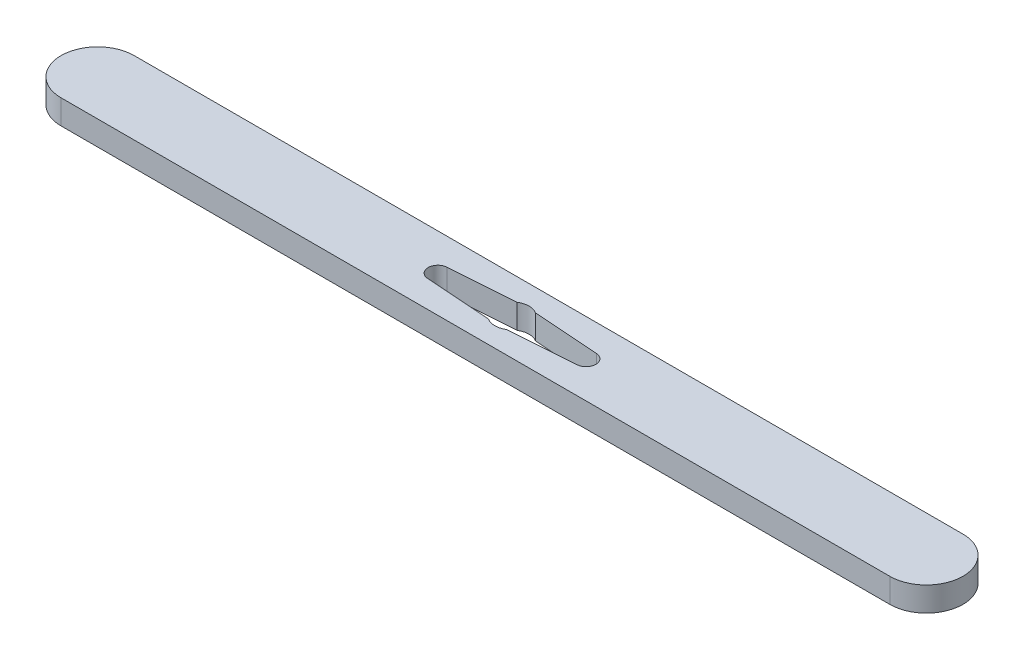
from build123d import *

# Parameters (mm, degrees)
BOSS_EXTRUDE1_DEPTH = 5
CUT_EXTRUDE3_DEPTH  = 93.938151477


with BuildPart() as part:
    # Sketch2 → Boss-Extrude1 (new body)
    with BuildSketch(Plane(origin=(0, 0, 0), x_dir=(1, 0, 0), z_dir=(0, 1, 0))):
        with BuildLine():
            ThreePointArc((85, -7.5), (92.5, 0), (85, 7.5))
            Line((85, 7.5), (-85, 7.5))
            ThreePointArc((-85, 7.5), (-92.5, 0), (-85, -7.5))
            Line((-85, -7.5), (85, -7.5))
        make_face()
    extrude(amount=BOSS_EXTRUDE1_DEPTH)

    # Sketch2<5> → Cut-Extrude3 (cut, through all)
    with BuildSketch(Plane(origin=(0, 0, 0), x_dir=(1, 0, 0), z_dir=(0, 1, 0))):
        with BuildLine():
            Line((-15.34156858, -1.994983292), (-1.88348082, -2.95))
            ThreePointArc((-1.88348082, -2.95), (0, -3.5), (1.88348082, -2.95))
            Line((1.88348082, -2.95), (15.34156858, -1.994983292))
            ThreePointArc((15.34156858, -1.994983292), (17.2, 0), (15.34156858, 1.994983292))
            Line((15.34156858, 1.994983292), (1.88348082, 2.95))
            ThreePointArc((1.88348082, 2.95), (0, 3.5), (-1.88348082, 2.95))
            Line((-1.88348082, 2.95), (-15.34156858, 1.994983292))
            ThreePointArc((-15.34156858, 1.994983292), (-17.2, 0), (-15.34156858, -1.994983292))
        make_face()
    extrude(amount=CUT_EXTRUDE3_DEPTH, mode=Mode.SUBTRACT)


solid = part.part
